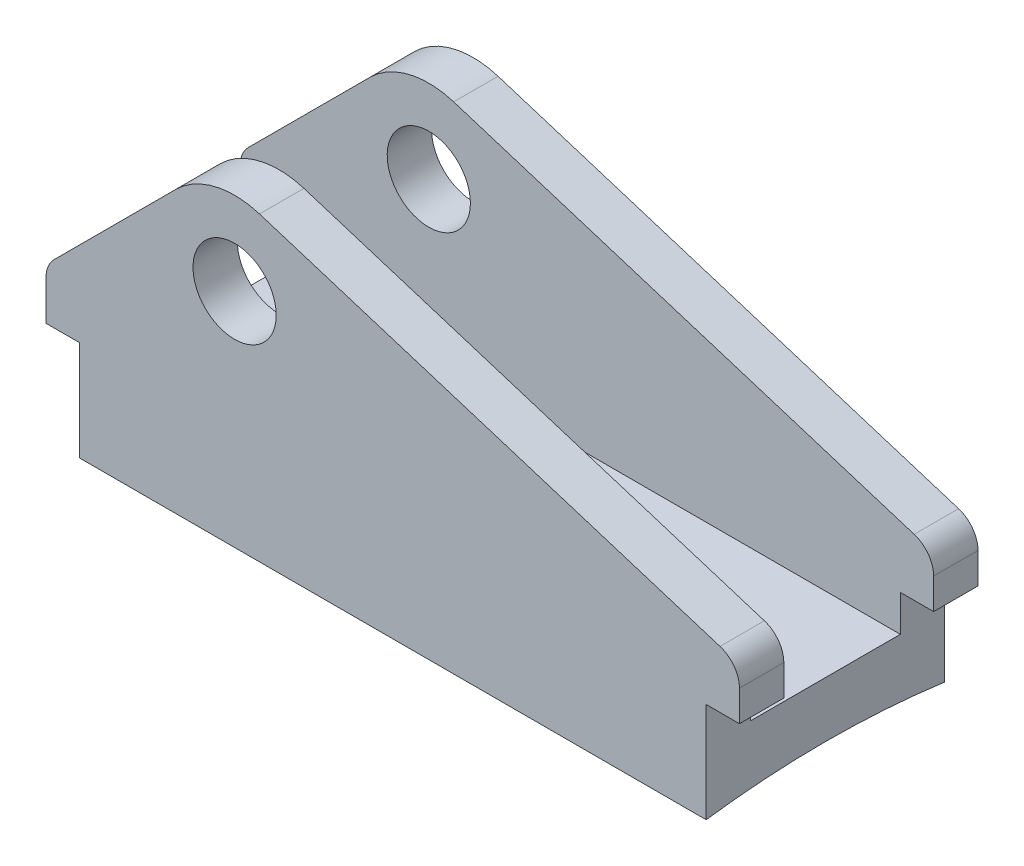
from build123d import *

# Parameters (mm, degrees)
SKETCH1_W           = 125
SKETCH1_H           = 43
BOSS_EXTRUDE1_DEPTH = 55
SKETCH2_OUTSIDE_W   = 155.634
SKETCH2_OUTSIDE_H   = 85.634
SKETCH2_OUTSIDE_R   = 7.5
CUT_EXTRUDE1_DEPTH  = 94.702988213
SKETCH8_R           = 160
CUT_EXTRUDE3_DEPTH  = 133.846716181
SKETCH3_W           = 27
SKETCH3_H           = 43.548888359
CUT_EXTRUDE2_DEPTH  = 139.247061452


with BuildPart() as part:
    # Sketch1 → Boss-Extrude1 (new body)
    with BuildSketch(Plane(origin=(0, 0, 0), x_dir=(1, 0, 0), z_dir=(0, 1, 0))):
        Rectangle(SKETCH1_W, SKETCH1_H)
    extrude(amount=BOSS_EXTRUDE1_DEPTH)

    # Sketch2 outside → Cut-Extrude1 (cut, through all)
    # profile 1 of 2: a face of its own
    with BuildSketch(Plane.XY.offset(21.5)):
        with Locations((0, 27.5)):
            Rectangle(SKETCH2_OUTSIDE_W, SKETCH2_OUTSIDE_H)
        with BuildLine():
            Line((-56.5, 18), (-56.5, 0))
            Line((-56.5, 0), (56.5, 0))
            Line((56.5, 0), (56.5, 18))
            Line((56.5, 18), (62.5, 18))
            Line((62.5, 18), (62.5, 23.539869777))
            ThreePointArc((62.5, 23.539869777), (61.529461255, 26.500180908), (58.994623203, 28.311253379))
            Line((58.994623203, 28.311253379), (-24.016130392, 54.314150807))
            ThreePointArc((-24.016130392, 54.314150807), (-32.078888401, 54.566796416), (-39.106601718, 50.606601718))
            Line((-39.106601718, 50.606601718), (-61.035533906, 28.67766953))
            ThreePointArc((-61.035533906, 28.67766953), (-62.119397663, 27.055552786), (-62.5, 25.142135624))
            Line((-62.5, 25.142135624), (-62.5, 18))
            Line((-62.5, 18), (-56.5, 18))
        make_face(mode=Mode.SUBTRACT)
    # profile 2 of 2: a face of its own
    with BuildSketch(Plane.XY.offset(21.5)):
        with Locations((-28.5, 40)):
            Circle(SKETCH2_OUTSIDE_R)
    extrude(amount=-CUT_EXTRUDE1_DEPTH, mode=Mode.SUBTRACT)

    # Sketch8 → Cut-Extrude3 (cut, through all)
    with BuildSketch(Plane(origin=(56.5, 0, 0), x_dir=(0, 0, -1), z_dir=(1, 0, 0))):
        with Locations((0, -158.548888359)):
            Circle(SKETCH8_R)
    extrude(amount=-CUT_EXTRUDE3_DEPTH, mode=Mode.SUBTRACT)

    # Sketch3 → Cut-Extrude2 (cut, through all)
    with BuildSketch(Plane(origin=(62.5, 0, 0), x_dir=(0, 0, -1), z_dir=(1, 0, 0))):
        with Locations((0, 33.22555582)):
            Rectangle(SKETCH3_W, SKETCH3_H)
    extrude(amount=-CUT_EXTRUDE2_DEPTH, mode=Mode.SUBTRACT)


solid = part.part
